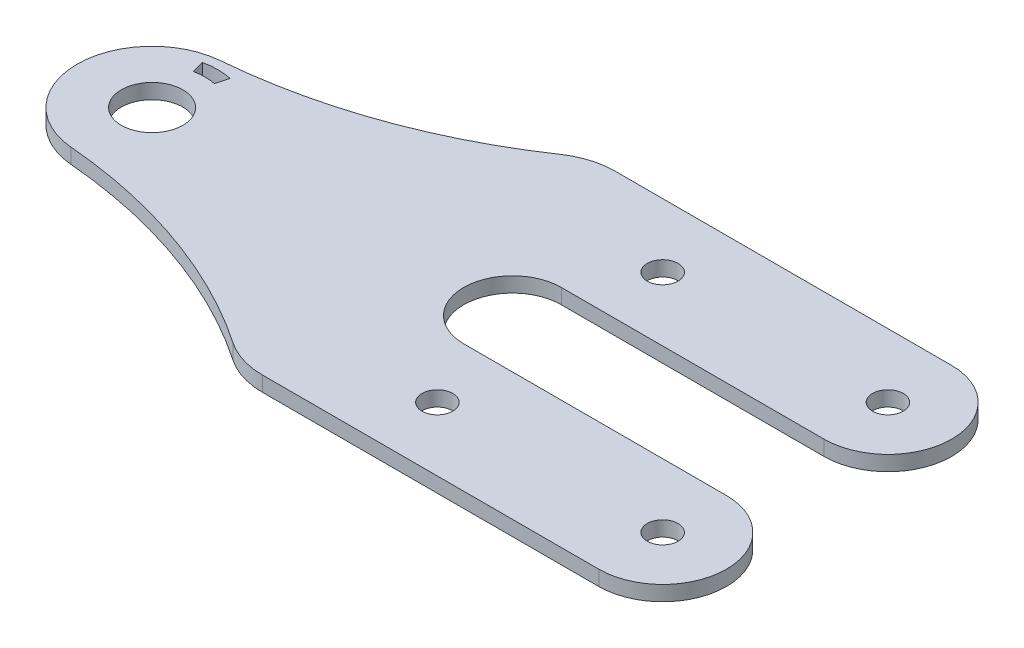
from build123d import *

# Parameters (mm, degrees)
SKETCH1_R           = 4.1
SKETCH1_R_2         = 2.05
BOSS_EXTRUDE1_DEPTH = 2
CUT_EXTRUDE1_DEPTH  = 95.490740287
FILLET1_DEPTH       = 2
FILLET2_R           = 10


with BuildPart() as part:
    # Sketch1 → Boss-Extrude1 (new body)
    with BuildSketch(Plane(origin=(0, 0, 0), x_dir=(1, 0, 0), z_dir=(0, 1, 0))):
        with BuildLine():
            Line((35, -10), (35, -23.5))
            Line((35, -23.5), (83, -23.5))
            ThreePointArc((83, -23.5), (91.5, -15), (83, -6.5))
            Line((83, -6.5), (48, -6.5))
            ThreePointArc((48, -6.5), (41.5, 0), (48, 6.5))
            Line((48, 6.5), (83, 6.5))
            ThreePointArc((83, 6.5), (91.5, 15), (83, 23.5))
            Line((83, 23.5), (35, 23.5))
            Line((35, 23.5), (35, 10))
            Line((35, 10), (0, 10))
            ThreePointArc((0, 10), (-10, 0), (0, -10))
            Line((0, -10), (35, -10))
        make_face()
        with Locations(Location((0, 0, 0), (0, 0, 270))):
            Circle(SKETCH1_R, mode=Mode.SUBTRACT)
        with Locations(Location((53, 15, 0), (0, 0, 270))):
            Circle(SKETCH1_R_2, mode=Mode.SUBTRACT)
        with Locations(Location((83, 15, 0), (0, 0, 270))):
            Circle(SKETCH1_R_2, mode=Mode.SUBTRACT)
        with Locations(Location((53, -15, 0), (0, 0, 270))):
            Circle(SKETCH1_R_2, mode=Mode.SUBTRACT)
        with Locations(Location((83, -15, 0), (0, 0, 270))):
            Circle(SKETCH1_R_2, mode=Mode.SUBTRACT)
    extrude(amount=BOSS_EXTRUDE1_DEPTH)

    # Sketch2 → Cut-Extrude1 (cut, through all)
    with BuildSketch(Plane(origin=(0, 2, 0), x_dir=(1, 0, 0), z_dir=(0, 1, 0))):
        with BuildLine():
            Line((-1.840672032, 8.554205192), (-1.4, 6.909594778))
            ThreePointArc((-1.4, 6.909594778), (0, 7.05), (1.4, 6.909594778))
            Line((1.4, 6.909594778), (1.840672032, 8.554205192))
            ThreePointArc((1.840672032, 8.554205192), (0, 8.75), (-1.840672032, 8.554205192))
        make_face()
    extrude(amount=-CUT_EXTRUDE1_DEPTH, mode=Mode.SUBTRACT)

    # Fillet1: read off the stored shape, not the designer's step
    # Fillet1 outline → Fillet1 (add)
    with BuildSketch(Plane(origin=(0, 0, 0), x_dir=(1, 0, 0), z_dir=(0, 1, 0))):
        with BuildLine():
            ThreePointArc((0, -10), (-0.41957616, -9.991193915), (-0.838413356, -9.964791169))
            ThreePointArc((-0.838413356, -9.964791169), (18.024740767, -14.233019392), (35, -23.5))
            Line((35, -23.5), (35, -10))
            Line((35, -10), (0, -10))
        make_face()
        with BuildLine():
            ThreePointArc((35, 23.5), (18.024740767, 14.233019392), (-0.838413356, 9.964791169))
            ThreePointArc((-0.838413356, 9.964791169), (-0.41957616, 9.991193915), (0, 10))
            Line((0, 10), (35, 10))
            Line((35, 10), (35, 23.5))
        make_face()
    extrude(amount=FILLET1_DEPTH)

    # Fillet2
    fillet2_edges = [part.edges().sort_by_distance(p)[0] for p in [
        (35, 1, -23.5),
        (35, 1, 23.5),
    ]]
    fillet(fillet2_edges, radius=FILLET2_R)


solid = part.part
